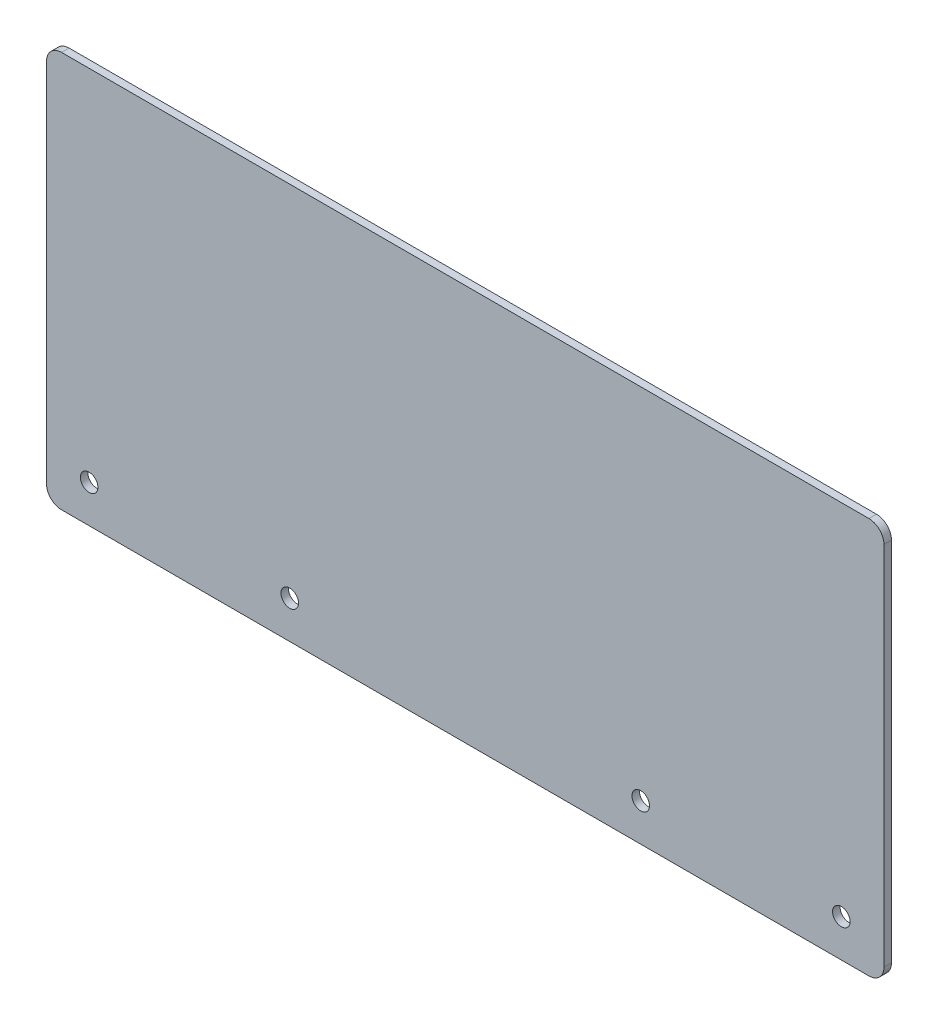
from build123d import *

# Parameters (mm, degrees)
ESQUISSE1_W                  = 167
ESQUISSE1_H                  = 79
BOSS_EXTRU_1_DEPTH           = 1.5
CONG_1_R                     = 3
ENL_V_MAT_EXTRU_1_DEPTH      = 185.749154261
ENL_V_MAT_EXTRU_1_DEPTH_BACK = 185.749154261
ESQUISSE2_R                  = 1.75


with BuildPart() as part:
    # Esquisse1 → Boss.-Extru.1 (new body)
    with BuildSketch(Plane.XY):
        with Locations((83.5, 39.5)):
            Rectangle(ESQUISSE1_W, ESQUISSE1_H)
    extrude(amount=BOSS_EXTRU_1_DEPTH)

    # Congé1
    cong_1_edges = [part.edges().sort_by_distance(p)[0] for p in [
        (167, 0, 0.75),
        (167, 79, 0.75),
        (0, 79, 0.75),
        (0, 0, 0.75),
    ]]
    fillet(cong_1_edges, radius=CONG_1_R)

    # Esquisse2 → Enlèv. mat.-Extru.1 (cut, two sides: drawn at the far end of the back side and taken through both)
    with BuildSketch(Plane.XY.offset(1.5).offset(-ENL_V_MAT_EXTRU_1_DEPTH_BACK)):
        with Locations((8.5, 7.5)):
            Circle(ESQUISSE2_R)
        with Locations((48.5, 7.5)):
            Circle(ESQUISSE2_R)
        with Locations((118.5, 7.5)):
            Circle(ESQUISSE2_R)
        with Locations((158.5, 7.5)):
            Circle(ESQUISSE2_R)
    extrude(amount=ENL_V_MAT_EXTRU_1_DEPTH + ENL_V_MAT_EXTRU_1_DEPTH_BACK, mode=Mode.SUBTRACT)


solid = part.part
